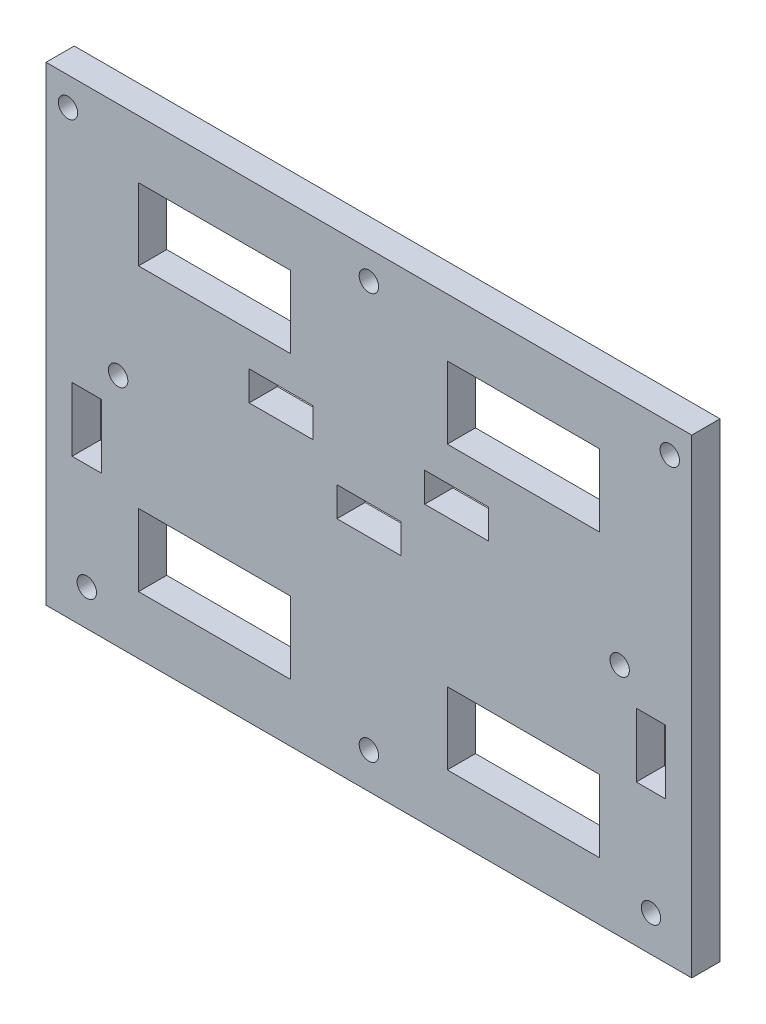
from build123d import *

# Parameters (mm, degrees)
SKETCH1_W           = 103
SKETCH1_H           = 75
SKETCH1_W_2         = 24.25
SKETCH1_H_2         = 11.5
BOSS_EXTRUDE1_DEPTH = 4.5
SKETCH2_R           = 1.55
SCREWHOLES_DEPTH    = 64.865092187
SKETCH3_W           = 10.2
SKETCH3_H           = 4.7
BELTCLAMP_DEPTH     = 64.865092187
SKETCH4_W           = 10.2
SKETCH4_H           = 4.7
CUT_EXTRUDE3_DEPTH  = 64.865092187
SKETCH5_R           = 1.55
SKETCH5_W           = 4.7
SKETCH5_H           = 10.2
CUT_EXTRUDE4_DEPTH  = 64.865092187


with BuildPart() as part:
    # Sketch1 → Boss-Extrude1 (new body)
    with BuildSketch(Plane.XY):
        Rectangle(SKETCH1_W, SKETCH1_H)
        with Locations((-24.625, 22.5)):
            Rectangle(SKETCH1_W_2, SKETCH1_H_2, mode=Mode.SUBTRACT)
        with Locations((24.625, 22.5)):
            Rectangle(SKETCH1_W_2, SKETCH1_H_2, mode=Mode.SUBTRACT)
        with Locations((24.625, -22.5)):
            Rectangle(SKETCH1_W_2, SKETCH1_H_2, mode=Mode.SUBTRACT)
        with Locations((-24.625, -22.5)):
            Rectangle(SKETCH1_W_2, SKETCH1_H_2, mode=Mode.SUBTRACT)
    extrude(amount=BOSS_EXTRUDE1_DEPTH)

    # Sketch2 → screwHoles (cut, through all)
    with BuildSketch(Plane.XY.offset(4.5)):
        with Locations((-48, 33)):
            Circle(SKETCH2_R)
        with Locations((48, 33)):
            Circle(SKETCH2_R)
        with Locations((40, 0)):
            Circle(SKETCH2_R)
        with Locations((-40, 0)):
            Circle(SKETCH2_R)
        with Locations((0, 33)):
            Circle(SKETCH2_R)
    extrude(amount=-SCREWHOLES_DEPTH, mode=Mode.SUBTRACT)

    # Sketch3 → BeltClamp (cut, through all)
    with BuildSketch(Plane.XY.offset(4.5)):
        with Locations((-14, 9)):
            Rectangle(SKETCH3_W, SKETCH3_H)
        with Locations((14, 9)):
            Rectangle(SKETCH3_W, SKETCH3_H)
    extrude(amount=-BELTCLAMP_DEPTH, mode=Mode.SUBTRACT)

    # Sketch4 → Cut-Extrude3 (cut, through all)
    with BuildSketch(Plane.XY.offset(4.5)):
        Rectangle(SKETCH4_W, SKETCH4_H)
    extrude(amount=-CUT_EXTRUDE3_DEPTH, mode=Mode.SUBTRACT)

    # Sketch5 → Cut-Extrude4 (cut, through all)
    with BuildSketch(Plane.XY.offset(4.5)):
        with Locations((45, -31.75)):
            Circle(SKETCH5_R)
        with Locations((-45, -31.75)):
            Circle(SKETCH5_R)
        with Locations((0, -31.75)):
            Circle(SKETCH5_R)
        with Locations((45, -9.75)):
            Rectangle(SKETCH5_W, SKETCH5_H)
        with Locations((-45, -9.75)):
            Rectangle(SKETCH5_W, SKETCH5_H)
    extrude(amount=-CUT_EXTRUDE4_DEPTH, mode=Mode.SUBTRACT)


solid = part.part
